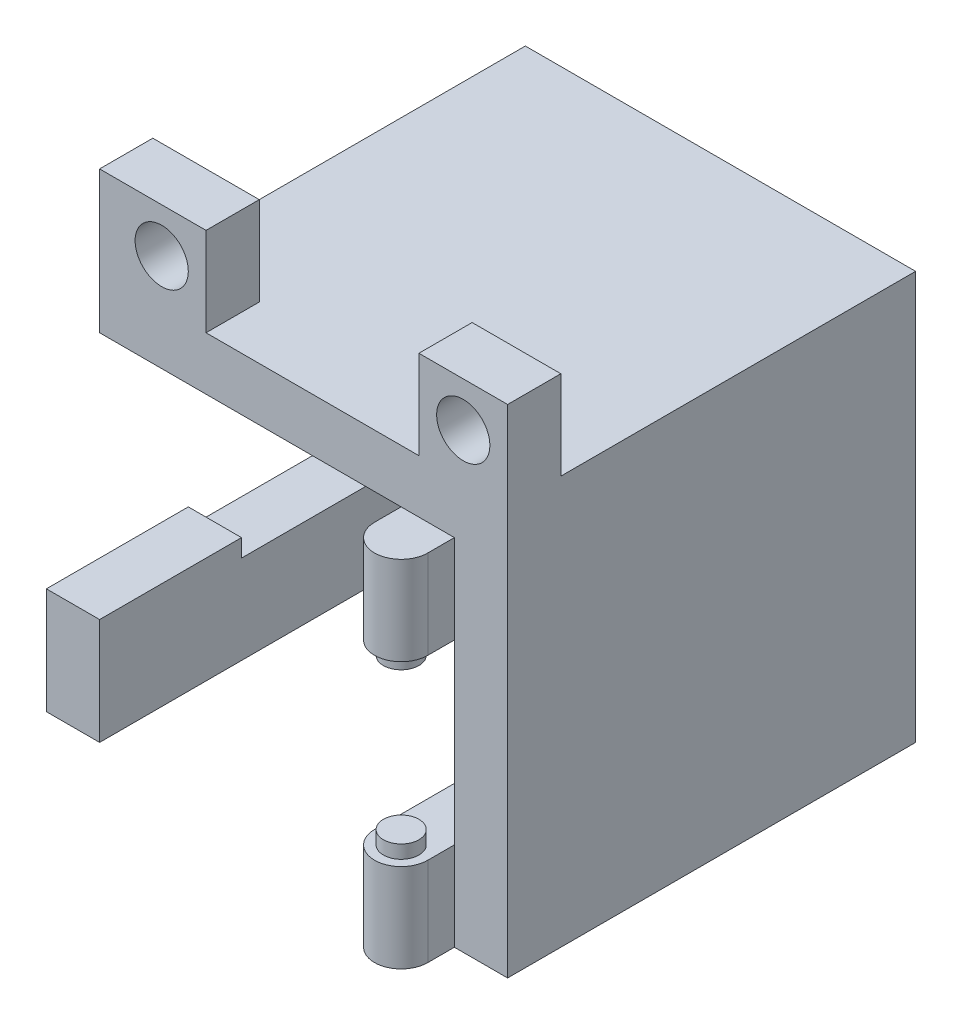
from build123d import *

# Parameters (mm, degrees)
CROQUIS1_W              = 26
CROQUIS1_H              = 23
SALIENTE_EXTRUIR1_DEPTH = 23
CROQUIS2_W              = 20
CROQUIS2_H              = 20
CORTAR_EXTRUIR1_DEPTH   = 20
CORTAR_EXTRUIR3_REACH   = 37.029
CROQUIS6_W              = 5
CROQUIS6_H              = 5
SALIENTE_EXTRUIR2_DEPTH = 3
CROQUIS7_R              = 1.5
CORTAR_EXTRUIR4_DEPTH   = 3
CROQUIS8_W              = 3
CROQUIS8_H              = 8
SALIENTE_EXTRUIR3_DEPTH = 1
SALIENTE_EXTRUIR4_DEPTH = 1
SALIENTE_EXTRUIR5_DEPTH = 5
CROQUIS12_R             = 1
SALIENTE_EXTRUIR7_DEPTH = 0.75


with BuildPart() as part:
    # Croquis1 → Saliente-Extruir1 (new body)
    with BuildSketch(Plane(origin=(0, 0, 0), x_dir=(1, 0, 0), z_dir=(0, 1, 0))):
        Rectangle(CROQUIS1_W, CROQUIS1_H)
    extrude(amount=SALIENTE_EXTRUIR1_DEPTH)

    # Croquis2 → Cortar-Extruir1 (cut)
    with BuildSketch(Plane.XY.offset(11.5)):
        with Locations((0, 10)):
            Rectangle(CROQUIS2_W, CROQUIS2_H)
    extrude(amount=-CORTAR_EXTRUIR1_DEPTH, mode=Mode.SUBTRACT)

    # Croquis5 → Cortar-Extruir3 (cut, up to next)
    with BuildSketch(Plane.XY.offset(11.5), mode=Mode.PRIVATE) as cortar_extruir3_sk1:
        Polygon((-13, 23), (-9, 23), (-9, 20), (-8, 20), (-8, 11), (-9, 11), (-9, 5), (-13, 5), align=None)
    cortar_extruir3_tool1 = extrude(cortar_extruir3_sk1.sketch, amount=-CORTAR_EXTRUIR3_REACH, mode=Mode.PRIVATE) & part.part
    add(cortar_extruir3_tool1.solids().sort_by_distance((-10.722222, 14.166667, 11.5))[0], mode=Mode.SUBTRACT)

    # Croquis6 → Saliente-Extruir2 (add)
    with BuildSketch(Plane.XY.offset(11.5)):
        with Locations((-6.5, 25.5)):
            Rectangle(CROQUIS6_W, CROQUIS6_H)
        with Locations((10.5, 25.5)):
            Rectangle(CROQUIS6_W, CROQUIS6_H)
    extrude(amount=-SALIENTE_EXTRUIR2_DEPTH)

    # Croquis7 → Cortar-Extruir4 (cut)
    with BuildSketch(Plane.XY.offset(11.5)):
        with Locations((-6.5, 25.5)):
            Circle(CROQUIS7_R)
        with Locations((10.5, 25.5)):
            Circle(CROQUIS7_R)
    extrude(amount=-CORTAR_EXTRUIR4_DEPTH, mode=Mode.SUBTRACT)

    # Croquis8 → Saliente-Extruir3 (add)
    with BuildSketch(Plane(origin=(0, 5, 0), x_dir=(1, 0, 0), z_dir=(0, 1, 0))):
        with Locations((-11.5, -7.5)):
            Rectangle(CROQUIS8_W, CROQUIS8_H)
    extrude(amount=SALIENTE_EXTRUIR3_DEPTH)

    # Croquis9 → Saliente-Extruir4 (add)
    with BuildSketch(Plane.ZY.offset(9)):
        Polygon((8.5, 23), (8.5, 28), (11.5, 28), (11.5, 20), (3.5, 20), (3.5, 23), align=None)
    extrude(amount=SALIENTE_EXTRUIR4_DEPTH)

    # Croquis10 → Saliente-Extruir5 (add)
    with BuildSketch(Plane.XZ):
        with BuildLine():
            Line((7, 8.5), (7, 11.5))
            Line((7, 11.5), (7, 13))
            ThreePointArc((7, 13), (8.5, 14.5), (10, 13))
            Line((10, 13), (10, 11.5))
            Line((10, 11.5), (10, 8.5))
            Line((10, 8.5), (7, 8.5))
        make_face()
    saliente_extruir5 = extrude(amount=-SALIENTE_EXTRUIR5_DEPTH)

    # Croquis12 → Saliente-Extruir7 (add)
    with BuildSketch(Plane(origin=(0, 5, 0), x_dir=(1, 0, 0), z_dir=(0, 1, 0))):
        with Locations((8.5, -13)):
            Circle(CROQUIS12_R)
    saliente_extruir7 = extrude(amount=SALIENTE_EXTRUIR7_DEPTH)

    # Simetría1: Saliente-Extruir5, Saliente-Extruir7 across plane
    add(saliente_extruir5.mirror(Plane(origin=(0, 10, 0), x_dir=(0, 0, 1), z_dir=(0, -1, 0))))
    add(saliente_extruir7.mirror(Plane(origin=(0, 10, 0), x_dir=(0, 0, 1), z_dir=(0, -1, 0))))


solid = part.part
